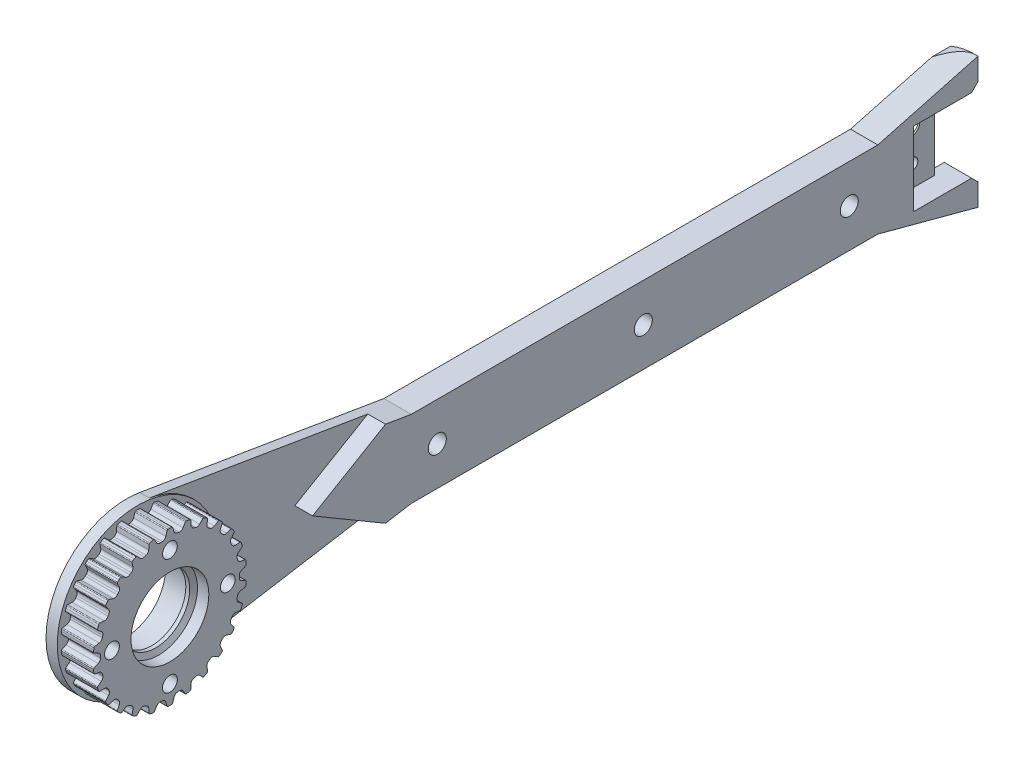
from build123d import *

# Parameters (mm, degrees)
CUT_EXTRUDE1_OUTLINE_R                          = 1.5
CUT_EXTRUDE1_DEPTH                              = 4.3
CUT_EXTRUDE1_START                              = 4.3
CUT_EXTRUDE1_2_OUTLINE_R                        = 9
CUT_EXTRUDE1_2_OUTLINE_R_2                      = 1.5
CUT_EXTRUDE1_2_DEPTH                            = 1.5
CUT_EXTRUDE2_START                              = -1
CUT_EXTRUDE2_OUTLINE_R                          = 12.5
CUT_EXTRUDE2_OUTLINE_R_2                        = 9
CUT_EXTRUDE2_DEPTH                              = 1
CUT_EXTRUDE4_DEPTH                              = 4.3
CIRPATTERN2_COUNT                               = 26
SKETCH6_R                                       = 12.5
SKETCH6_R_2                                     = 1.5
BOSS_EXTRUDE1_DEPTH                             = 0.5
SKETCH9_R                                       = 12.5
CUT_EXTRUDE5_DEPTH                              = 1.5
SKETCH10_R                                      = 6.05
CUT_EXTRUDE6_DEPTH                              = 18.364284683
SKETCH13_R                                      = 1.15
CUT_EXTRUDE7_DEPTH                              = 18.364284683
BOSS_EXTRUDE2_START                             = 1.75
SKETCH14_R                                      = 1.15
SKETCH14_R_2                                    = 6.05
BOSS_EXTRUDE2_DEPTH                             = 1.75
CUT_EXTRUDE9_START                              = -0.25
CUT_EXTRUDE9_DEPTH                              = 0.25
BOSS_EXTRUDE3_DEPTH                             = 2.75
BOSS_EXTRUDE5_DEPTH                             = 4.25
CUT_EXTRUDE14_DEPTH                             = 10
SKETCH31_W                                      = 5.8
SKETCH31_H                                      = 11.5
CUT_EXTRUDE15_DEPTH                             = 10
CUT_EXTRUDE16_REACH                             = 130.718
CUT_EXTRUDE16_DIRECTION_2_REACH                 = 130.718
CHAMFER1_SIZE                                   = 1
SKETCH33_R                                      = 1.4
SKETCH33_R_2                                    = 0.9
CUT_EXTRUDE17_DEPTH                             = 129.800834625
CUT_EXTRUDE18_DEPTH                             = 2
SKETCH35_R                                      = 1.15
SKETCH35_R_2                                    = 6.05
BOSS_EXTRUDE6_DEPTH                             = 0.7
CSK_FOR_M2_FLAT_HEAD_MACHINE_SCREW1_D           = 2.2
CSK_FOR_M2_FLAT_HEAD_MACHINE_SCREW1_DEPTH       = 7
CSK_FOR_M2_FLAT_HEAD_MACHINE_SCREW1_CSINK_D     = 4.4
CSK_FOR_M2_FLAT_HEAD_MACHINE_SCREW1_CSINK_ANGLE = 90
CSK_FOR_M2_FLAT_HEAD_MACHINE_SCREW1_TIP         = 0.660946681
SKETCH41_W                                      = 72.486755268
SKETCH41_H                                      = 12
SACRIFICIAL_LAYER_DEPTH                         = 0.15


with BuildPart() as part:
    # Cut-Extrude1: read off the stored shape, not the designer's step
    # Cut-Extrude1 outline → Cut-Extrude1 (new body)
    with BuildSketch(Plane(origin=(-2.15, 0, 0), x_dir=(0, 0, -1), z_dir=(1, 0, 0))):
        with BuildLine():
            ThreePointArc((-5.975200822, 10.283087853), (-5.974138485, 10.259881419), (-5.970960361, 10.236869104))
            Line((-5.970960361, 10.236869104), (-5.843579025, 9.548518492))
            ThreePointArc((-5.843579025, 9.548518492), (-5.874898732, 9.258968465), (-6.060105603, 9.03420513))
            ThreePointArc((-6.060105603, 9.03420513), (-6.179691825, 8.952829229), (-6.298185474, 8.869870461))
            ThreePointArc((-6.298185474, 8.869870461), (-6.574018104, 8.776401206), (-6.855858203, 8.849792625))
            Line((-6.855858203, 8.849792625), (-7.454307162, 9.212988734))
            ThreePointArc((-7.454307162, 9.212988734), (-7.605767601, 9.24908541), (-7.749833168, 9.190023179))
            ThreePointArc((-7.749833168, 9.190023179), (-7.971728427, 8.998221271), (-8.188878401, 8.801063044))
            ThreePointArc((-8.188878401, 8.801063044), (-8.248734135, 8.716518561), (-8.269857124, 8.615107033))
            ThreePointArc((-8.269857124, 8.615107033), (-8.264153361, 8.561581534), (-8.247298234, 8.510459948))
            Line((-8.247298234, 8.510459948), (-7.958885285, 7.872595902))
            ThreePointArc((-7.958885285, 7.872595902), (-7.920001041, 7.583964377), (-8.04603675, 7.32140935))
            ThreePointArc((-8.04603675, 7.32140935), (-8.142673486, 7.213779228), (-8.237870592, 7.104873706))
            ThreePointArc((-8.237870592, 7.104873706), (-8.483319371, 6.948109427), (-8.774533425, 6.951919475))
            Line((-8.774533425, 6.951919475), (-9.442511063, 7.161343555))
            ThreePointArc((-9.442511063, 7.161343555), (-9.598208837, 7.160144472), (-9.723953603, 7.068321335))
            ThreePointArc((-9.723953603, 7.068321335), (-9.893499788, 6.828989831), (-10.057156726, 6.585593273))
            ThreePointArc((-10.057156726, 6.585593273), (-10.088063831, 6.519049409), (-10.098660947, 6.446447508))
            ThreePointArc((-10.098660947, 6.446447508), (-10.084695038, 6.363383466), (-10.044333112, 6.289453793))
            Line((-10.044333112, 6.289453793), (-9.611650061, 5.739146654))
            ThreePointArc((-9.611650061, 5.739146654), (-9.504821678, 5.468207845), (-9.564361488, 5.183119871))
            ThreePointArc((-9.564361488, 5.183119871), (-9.632432562, 5.0554906), (-9.698800615, 4.926967515))
            ThreePointArc((-9.698800615, 4.926967515), (-9.899600951, 4.716018785), (-10.183264658, 4.650026034))
            Line((-10.183264658, 4.650026034), (-10.881950543, 4.693507119))
            ThreePointArc((-10.881950543, 4.693507119), (-11.032837063, 4.655081963), (-11.132953199, 4.535834347))
            ThreePointArc((-11.132953199, 4.535834347), (-11.240296902, 4.262882324), (-11.340949658, 3.987392759))
            ThreePointArc((-11.340949658, 3.987392759), (-11.351708254, 3.945877461), (-11.355328859, 3.903143885))
            ThreePointArc((-11.355328859, 3.903143885), (-11.329600568, 3.791752561), (-11.257627859, 3.702927445))
            Line((-11.257627859, 3.702927445), (-10.705820672, 3.272159063))
            ThreePointArc((-10.705820672, 3.272159063), (-10.537256627, 3.034658948), (-10.5268403, 2.743606304))
            ThreePointArc((-10.5268403, 2.743606304), (-10.562389669, 2.603395234), (-10.5960716, 2.462723882))
            ThreePointArc((-10.5960716, 2.462723882), (-10.740553707, 2.209850272), (-11.000181563, 2.077889983))
            Line((-11.000181563, 2.077889983), (-11.688970611, 1.952901109))
            ThreePointArc((-11.688970611, 1.952901109), (-11.826276901, 1.879483011), (-11.894946022, 1.739741154))
            ThreePointArc((-11.894946022, 1.739741154), (-11.933848818, 1.449031591), (-11.965647819, 1.157459471))
            ThreePointArc((-11.965647819, 1.157459471), (-11.966532701, 1.145245826), (-11.96682789, 1.133003727))
            ThreePointArc((-11.96682789, 1.133003727), (-11.926008501, 0.994909457), (-11.816670195, 0.901200414))
            Line((-11.816670195, 0.901200414), (-11.177807901, 0.615005482))
            ThreePointArc((-11.177807901, 0.615005482), (-10.957304522, 0.424746706), (-10.877537418, 0.144644312))
            ThreePointArc((-10.877537418, 0.144644312), (-10.878258663, 0.072323754), (-10.878499081, 0))
            ThreePointArc((-10.878499081, 0), (-10.878258663, -0.072323754), (-10.877537418, -0.144644312))
            ThreePointArc((-10.877537418, -0.144644312), (-10.957304522, -0.424746706), (-11.177807901, -0.615005482))
            Line((-11.177807901, -0.615005482), (-11.816670195, -0.901200414))
            ThreePointArc((-11.816670195, -0.901200414), (-11.926008501, -0.994909457), (-11.96682789, -1.133003727))
            ThreePointArc((-11.96682789, -1.133003727), (-11.966532701, -1.145245826), (-11.965647819, -1.157459471))
            ThreePointArc((-11.965647819, -1.157459471), (-11.933848818, -1.449031591), (-11.894946022, -1.739741154))
            ThreePointArc((-11.894946022, -1.739741154), (-11.826276901, -1.879483011), (-11.688970611, -1.952901109))
            Line((-11.688970611, -1.952901109), (-11.000181563, -2.077889983))
            ThreePointArc((-11.000181563, -2.077889983), (-10.740553707, -2.209850272), (-10.5960716, -2.462723882))
            ThreePointArc((-10.5960716, -2.462723882), (-10.562389669, -2.603395234), (-10.5268403, -2.743606304))
            ThreePointArc((-10.5268403, -2.743606304), (-10.537256627, -3.034658948), (-10.705820672, -3.272159063))
            Line((-10.705820672, -3.272159063), (-11.257627859, -3.702927445))
            ThreePointArc((-11.257627859, -3.702927445), (-11.329600568, -3.791752561), (-11.355328859, -3.903143885))
            ThreePointArc((-11.355328859, -3.903143885), (-11.351708254, -3.945877461), (-11.340949658, -3.987392759))
            ThreePointArc((-11.340949658, -3.987392759), (-11.240296902, -4.262882324), (-11.132953199, -4.535834347))
            ThreePointArc((-11.132953199, -4.535834347), (-11.032837063, -4.655081963), (-10.881950543, -4.693507119))
            Line((-10.881950543, -4.693507119), (-10.183264658, -4.650026034))
            ThreePointArc((-10.183264658, -4.650026034), (-9.899600951, -4.716018785), (-9.698800615, -4.926967515))
            ThreePointArc((-9.698800615, -4.926967515), (-9.632432562, -5.0554906), (-9.564361488, -5.183119871))
            ThreePointArc((-9.564361488, -5.183119871), (-9.504821678, -5.468207845), (-9.611650061, -5.739146654))
            Line((-9.611650061, -5.739146654), (-10.044333112, -6.289453793))
            ThreePointArc((-10.044333112, -6.289453793), (-10.084695038, -6.363383466), (-10.098660947, -6.446447508))
            ThreePointArc((-10.098660947, -6.446447508), (-10.088063831, -6.519049409), (-10.057156726, -6.585593273))
            ThreePointArc((-10.057156726, -6.585593273), (-9.893499788, -6.828989831), (-9.723953603, -7.068321335))
            ThreePointArc((-9.723953603, -7.068321335), (-9.598208837, -7.160144472), (-9.442511063, -7.161343555))
            Line((-9.442511063, -7.161343555), (-8.774533425, -6.951919475))
            ThreePointArc((-8.774533425, -6.951919475), (-8.483319371, -6.948109427), (-8.237870592, -7.104873706))
            ThreePointArc((-8.237870592, -7.104873706), (-8.142673486, -7.213779228), (-8.04603675, -7.32140935))
            ThreePointArc((-8.04603675, -7.32140935), (-7.920001041, -7.583964377), (-7.958885285, -7.872595902))
            Line((-7.958885285, -7.872595902), (-8.247298234, -8.510459948))
            ThreePointArc((-8.247298234, -8.510459948), (-8.264153361, -8.561581534), (-8.269857124, -8.615107033))
            ThreePointArc((-8.269857124, -8.615107033), (-8.248734135, -8.716518561), (-8.188878401, -8.801063044))
            ThreePointArc((-8.188878401, -8.801063044), (-7.971728427, -8.998221271), (-7.749833168, -9.190023179))
            ThreePointArc((-7.749833168, -9.190023179), (-7.605767601, -9.24908541), (-7.454307162, -9.212988734))
            Line((-7.454307162, -9.212988734), (-6.855858203, -8.849792625))
            ThreePointArc((-6.855858203, -8.849792625), (-6.574018104, -8.776401206), (-6.298185474, -8.869870461))
            ThreePointArc((-6.298185474, -8.869870461), (-6.179691825, -8.952829229), (-6.060105603, -9.03420513))
            ThreePointArc((-6.060105603, -9.03420513), (-5.874898732, -9.258968465), (-5.843579025, -9.548518492))
            Line((-5.843579025, -9.548518492), (-5.970960361, -10.236869104))
            ThreePointArc((-5.970960361, -10.236869104), (-5.974138485, -10.259881419), (-5.975200822, -10.283087853))
            ThreePointArc((-5.975200822, -10.283087853), (-5.940156088, -10.411830198), (-5.844692228, -10.505047021))
            ThreePointArc((-5.844692228, -10.505047021), (-5.586669186, -10.644508799), (-5.325320599, -10.77763428))
            ThreePointArc((-5.325320599, -10.77763428), (-5.171306799, -10.800503124), (-5.032886025, -10.729208496))
            Line((-5.032886025, -10.729208496), (-4.538745423, -10.233347995))
            ThreePointArc((-4.538745423, -10.233347995), (-4.282658801, -10.094640447), (-3.992472709, -10.119382587))
            ThreePointArc((-3.992472709, -10.119382587), (-3.857568938, -10.171573337), (-3.721983146, -10.221965746))
            ThreePointArc((-3.721983146, -10.221965746), (-3.488368663, -10.395874962), (-3.388665193, -10.669515894))
            Line((-3.388665193, -10.669515894), (-3.347611975, -11.368348638))
            ThreePointArc((-3.347611975, -11.368348638), (-3.291279621, -11.513503385), (-3.160833788, -11.59851585))
            ThreePointArc((-3.160833788, -11.59851585), (-2.876933038, -11.672176166), (-2.591319753, -11.738888452))
            ThreePointArc((-2.591319753, -11.738888452), (-2.436308442, -11.724234854), (-2.318971846, -11.621885659))
            Line((-2.318971846, -11.621885659), (-1.957857256, -11.022178377))
            ThreePointArc((-1.957857256, -11.022178377), (-1.742406936, -10.826215878), (-1.454731942, -10.780792978))
            ThreePointArc((-1.454731942, -10.780792978), (-1.311258166, -10.799182575), (-1.167552558, -10.815662869))
            ThreePointArc((-1.167552558, -10.815662869), (-0.899107288, -10.928610993), (-0.736814457, -11.170439815))
            Line((-0.736814457, -11.170439815), (-0.529712549, -11.839141071))
            ThreePointArc((-0.529712549, -11.839141071), (-0.440279306, -11.96659667), (-0.293279177, -12.017921097))
            ThreePointArc((-0.293279177, -12.017921097), (0, -12.021499081), (0.293279177, -12.017921097))
            ThreePointArc((0.293279177, -12.017921097), (0.440279306, -11.96659667), (0.529712549, -11.839141071))
            Line((0.529712549, -11.839141071), (0.736814457, -11.170439815))
            ThreePointArc((0.736814457, -11.170439815), (0.899107288, -10.928610993), (1.167552558, -10.815662869))
            ThreePointArc((1.167552558, -10.815662869), (1.311258166, -10.799182575), (1.454731942, -10.780792978))
            ThreePointArc((1.454731942, -10.780792978), (1.742406936, -10.826215878), (1.957857256, -11.022178377))
            Line((1.957857256, -11.022178377), (2.318971846, -11.621885659))
            ThreePointArc((2.318971846, -11.621885659), (2.436308442, -11.724234854), (2.591319753, -11.738888452))
            ThreePointArc((2.591319753, -11.738888452), (2.876933038, -11.672176166), (3.160833788, -11.59851585))
            ThreePointArc((3.160833788, -11.59851585), (3.291279621, -11.513503385), (3.347611975, -11.368348638))
            Line((3.347611975, -11.368348638), (3.388665193, -10.669515894))
            ThreePointArc((3.388665193, -10.669515894), (3.488368663, -10.395874962), (3.721983146, -10.221965746))
            ThreePointArc((3.721983146, -10.221965746), (3.857568938, -10.171573337), (3.992472709, -10.119382587))
            ThreePointArc((3.992472709, -10.119382587), (4.282658801, -10.094640447), (4.538745423, -10.233347995))
            Line((4.538745423, -10.233347995), (5.032886025, -10.729208496))
            ThreePointArc((5.032886025, -10.729208496), (5.171306799, -10.800503124), (5.325320599, -10.77763428))
            ThreePointArc((5.325320599, -10.77763428), (5.586669186, -10.644508799), (5.844692228, -10.505047021))
            ThreePointArc((5.844692228, -10.505047021), (5.951002727, -10.391287132), (5.970960361, -10.236869104))
            Line((5.970960361, -10.236869104), (5.843579025, -9.548518492))
            ThreePointArc((5.843579025, -9.548518492), (5.837222777, -9.502493862), (5.835098103, -9.456080995))
            ThreePointArc((5.835098103, -9.456080995), (5.894865914, -9.217016349), (6.060105603, -9.03420513))
            ThreePointArc((6.060105603, -9.03420513), (6.179691825, -8.952829229), (6.298185474, -8.869870461))
            ThreePointArc((6.298185474, -8.869870461), (6.574018104, -8.776401206), (6.855858203, -8.849792625))
            Line((6.855858203, -8.849792625), (7.454307162, -9.212988734))
            ThreePointArc((7.454307162, -9.212988734), (7.605767601, -9.24908541), (7.749833168, -9.190023179))
            ThreePointArc((7.749833168, -9.190023179), (7.971728427, -8.998221271), (8.188878401, -8.801063044))
            ThreePointArc((8.188878401, -8.801063044), (8.264875187, -8.665167043), (8.247298234, -8.510459948))
            Line((8.247298234, -8.510459948), (7.958885285, -7.872595902))
            ThreePointArc((7.958885285, -7.872595902), (7.925175032, -7.770352728), (7.913767505, -7.663301731))
            ThreePointArc((7.913767505, -7.663301731), (7.947987375, -7.480008555), (8.04603675, -7.32140935))
            ThreePointArc((8.04603675, -7.32140935), (8.142673486, -7.213779228), (8.237870592, -7.104873706))
            ThreePointArc((8.237870592, -7.104873706), (8.483319371, -6.948109427), (8.774533425, -6.951919475))
            Line((8.774533425, -6.951919475), (9.442511063, -7.161343555))
            ThreePointArc((9.442511063, -7.161343555), (9.598208837, -7.160144472), (9.723953603, -7.068321335))
            ThreePointArc((9.723953603, -7.068321335), (9.893499788, -6.828989831), (10.057156726, -6.585593273))
            ThreePointArc((10.057156726, -6.585593273), (10.098423142, -6.435458941), (10.044333112, -6.289453793))
            Line((10.044333112, -6.289453793), (9.611650061, -5.739146654))
            ThreePointArc((9.611650061, -5.739146654), (9.530926209, -5.591287308), (9.502994392, -5.425159225))
            ThreePointArc((9.502994392, -5.425159225), (9.518575101, -5.300310347), (9.564361488, -5.183119871))
            ThreePointArc((9.564361488, -5.183119871), (9.632432562, -5.0554906), (9.698800615, -4.926967515))
            ThreePointArc((9.698800615, -4.926967515), (9.899600951, -4.716018785), (10.183264658, -4.650026034))
            Line((10.183264658, -4.650026034), (10.881950543, -4.693507119))
            ThreePointArc((10.881950543, -4.693507119), (11.032837063, -4.655081963), (11.132953199, -4.535834347))
            ThreePointArc((11.132953199, -4.535834347), (11.240296902, -4.262882324), (11.340949658, -3.987392759))
            ThreePointArc((11.340949658, -3.987392759), (11.34508745, -3.831745358), (11.257627859, -3.702927445))
            Line((11.257627859, -3.702927445), (10.705820672, -3.272159063))
            ThreePointArc((10.705820672, -3.272159063), (10.561875255, -3.094508832), (10.510418673, -2.871726185))
            ThreePointArc((10.510418673, -2.871726185), (10.514540804, -2.807142182), (10.5268403, -2.743606304))
            ThreePointArc((10.5268403, -2.743606304), (10.562389669, -2.603395234), (10.5960716, -2.462723882))
            ThreePointArc((10.5960716, -2.462723882), (10.740553707, -2.209850272), (11.000181563, -2.077889983))
            Line((11.000181563, -2.077889983), (11.688970611, -1.952901109))
            ThreePointArc((11.688970611, -1.952901109), (11.826276901, -1.879483011), (11.894946022, -1.739741154))
            ThreePointArc((11.894946022, -1.739741154), (11.933848818, -1.449031591), (11.965647819, -1.157459471))
            ThreePointArc((11.965647819, -1.157459471), (11.932416513, -1.005344663), (11.816670195, -0.901200414))
            Line((11.816670195, -0.901200414), (11.177807901, -0.615005482))
            ThreePointArc((11.177807901, -0.615005482), (10.95913129, -0.427587396), (10.877492511, -0.151398857))
            ThreePointArc((10.877492511, -0.151398857), (10.877503738, -0.14802151), (10.877537418, -0.144644312))
            ThreePointArc((10.877537418, -0.144644312), (10.878499081, 0), (10.877537418, 0.144644312))
            ThreePointArc((10.877537418, 0.144644312), (10.877503738, 0.14802151), (10.877492511, 0.151398857))
            ThreePointArc((10.877492511, 0.151398857), (10.95913129, 0.427587396), (11.177807901, 0.615005482))
            Line((11.177807901, 0.615005482), (11.816670195, 0.901200414))
            ThreePointArc((11.816670195, 0.901200414), (11.932416513, 1.005344663), (11.965647819, 1.157459471))
            ThreePointArc((11.965647819, 1.157459471), (11.933848818, 1.449031591), (11.894946022, 1.739741154))
            ThreePointArc((11.894946022, 1.739741154), (11.826276901, 1.879483011), (11.688970611, 1.952901109))
            Line((11.688970611, 1.952901109), (11.000181563, 2.077889983))
            ThreePointArc((11.000181563, 2.077889983), (10.740553707, 2.209850272), (10.5960716, 2.462723882))
            ThreePointArc((10.5960716, 2.462723882), (10.562389669, 2.603395234), (10.5268403, 2.743606304))
            ThreePointArc((10.5268403, 2.743606304), (10.514540804, 2.807142182), (10.510418673, 2.871726185))
            ThreePointArc((10.510418673, 2.871726185), (10.561875255, 3.094508832), (10.705820672, 3.272159063))
            Line((10.705820672, 3.272159063), (11.257627859, 3.702927445))
            ThreePointArc((11.257627859, 3.702927445), (11.34508745, 3.831745358), (11.340949658, 3.987392759))
            ThreePointArc((11.340949658, 3.987392759), (11.240296902, 4.262882324), (11.132953199, 4.535834347))
            ThreePointArc((11.132953199, 4.535834347), (11.032837063, 4.655081963), (10.881950543, 4.693507119))
            Line((10.881950543, 4.693507119), (10.183264658, 4.650026034))
            ThreePointArc((10.183264658, 4.650026034), (9.899600951, 4.716018785), (9.698800615, 4.926967515))
            ThreePointArc((9.698800615, 4.926967515), (9.632432562, 5.0554906), (9.564361488, 5.183119871))
            ThreePointArc((9.564361488, 5.183119871), (9.518575101, 5.300310347), (9.502994392, 5.425159225))
            ThreePointArc((9.502994392, 5.425159225), (9.530926209, 5.591287308), (9.611650061, 5.739146654))
            Line((9.611650061, 5.739146654), (10.044333112, 6.289453793))
            ThreePointArc((10.044333112, 6.289453793), (10.098423142, 6.435458941), (10.057156726, 6.585593273))
            ThreePointArc((10.057156726, 6.585593273), (9.893499788, 6.828989831), (9.723953603, 7.068321335))
            ThreePointArc((9.723953603, 7.068321335), (9.598208837, 7.160144472), (9.442511063, 7.161343555))
            Line((9.442511063, 7.161343555), (8.774533425, 6.951919475))
            ThreePointArc((8.774533425, 6.951919475), (8.483319371, 6.948109427), (8.237870592, 7.104873706))
            ThreePointArc((8.237870592, 7.104873706), (8.142673486, 7.213779228), (8.04603675, 7.32140935))
            ThreePointArc((8.04603675, 7.32140935), (7.947987375, 7.480008555), (7.913767505, 7.663301731))
            ThreePointArc((7.913767505, 7.663301731), (7.925175032, 7.770352728), (7.958885285, 7.872595902))
            Line((7.958885285, 7.872595902), (8.247298234, 8.510459948))
            ThreePointArc((8.247298234, 8.510459948), (8.264875187, 8.665167043), (8.188878401, 8.801063044))
            ThreePointArc((8.188878401, 8.801063044), (7.971728427, 8.998221271), (7.749833168, 9.190023179))
            ThreePointArc((7.749833168, 9.190023179), (7.605767601, 9.24908541), (7.454307162, 9.212988734))
            Line((7.454307162, 9.212988734), (6.855858203, 8.849792625))
            ThreePointArc((6.855858203, 8.849792625), (6.574018104, 8.776401206), (6.298185474, 8.869870461))
            ThreePointArc((6.298185474, 8.869870461), (6.179691825, 8.952829229), (6.060105603, 9.03420513))
            ThreePointArc((6.060105603, 9.03420513), (5.894865914, 9.217016349), (5.835098103, 9.456080995))
            ThreePointArc((5.835098103, 9.456080995), (5.837222777, 9.502493862), (5.843579025, 9.548518492))
            Line((5.843579025, 9.548518492), (5.970960361, 10.236869104))
            ThreePointArc((5.970960361, 10.236869104), (5.951002727, 10.391287132), (5.844692228, 10.505047021))
            ThreePointArc((5.844692228, 10.505047021), (5.586669186, 10.644508799), (5.325320599, 10.77763428))
            ThreePointArc((5.325320599, 10.77763428), (5.171306799, 10.800503124), (5.032886025, 10.729208496))
            Line((5.032886025, 10.729208496), (4.538745423, 10.233347995))
            ThreePointArc((4.538745423, 10.233347995), (4.282658801, 10.094640447), (3.992472709, 10.119382587))
            ThreePointArc((3.992472709, 10.119382587), (3.857568938, 10.171573337), (3.721983146, 10.221965746))
            ThreePointArc((3.721983146, 10.221965746), (3.488368663, 10.395874962), (3.388665193, 10.669515894))
            Line((3.388665193, 10.669515894), (3.347611975, 11.368348638))
            ThreePointArc((3.347611975, 11.368348638), (3.291279621, 11.513503385), (3.160833788, 11.59851585))
            ThreePointArc((3.160833788, 11.59851585), (2.876933038, 11.672176166), (2.591319753, 11.738888452))
            ThreePointArc((2.591319753, 11.738888452), (2.436308442, 11.724234854), (2.318971846, 11.621885659))
            Line((2.318971846, 11.621885659), (1.957857256, 11.022178377))
            ThreePointArc((1.957857256, 11.022178377), (1.742406936, 10.826215878), (1.454731942, 10.780792978))
            ThreePointArc((1.454731942, 10.780792978), (1.311258166, 10.799182575), (1.167552558, 10.815662869))
            ThreePointArc((1.167552558, 10.815662869), (0.899107288, 10.928610993), (0.736814457, 11.170439815))
            Line((0.736814457, 11.170439815), (0.529712549, 11.839141071))
            ThreePointArc((0.529712549, 11.839141071), (0.440279306, 11.96659667), (0.293279177, 12.017921097))
            ThreePointArc((0.293279177, 12.017921097), (0, 12.021499081), (-0.293279177, 12.017921097))
            ThreePointArc((-0.293279177, 12.017921097), (-0.440279306, 11.96659667), (-0.529712549, 11.839141071))
            Line((-0.529712549, 11.839141071), (-0.736814457, 11.170439815))
            ThreePointArc((-0.736814457, 11.170439815), (-0.899107288, 10.928610993), (-1.167552558, 10.815662869))
            ThreePointArc((-1.167552558, 10.815662869), (-1.311258166, 10.799182575), (-1.454731942, 10.780792978))
            ThreePointArc((-1.454731942, 10.780792978), (-1.742406936, 10.826215878), (-1.957857256, 11.022178377))
            Line((-1.957857256, 11.022178377), (-2.318971846, 11.621885659))
            ThreePointArc((-2.318971846, 11.621885659), (-2.436308442, 11.724234854), (-2.591319753, 11.738888452))
            ThreePointArc((-2.591319753, 11.738888452), (-2.876933038, 11.672176166), (-3.160833788, 11.59851585))
            ThreePointArc((-3.160833788, 11.59851585), (-3.291279621, 11.513503385), (-3.347611975, 11.368348638))
            Line((-3.347611975, 11.368348638), (-3.388665193, 10.669515894))
            ThreePointArc((-3.388665193, 10.669515894), (-3.488368663, 10.395874962), (-3.721983146, 10.221965746))
            ThreePointArc((-3.721983146, 10.221965746), (-3.857568938, 10.171573337), (-3.992472709, 10.119382587))
            ThreePointArc((-3.992472709, 10.119382587), (-4.282658801, 10.094640447), (-4.538745423, 10.233347995))
            Line((-4.538745423, 10.233347995), (-5.032886025, 10.729208496))
            ThreePointArc((-5.032886025, 10.729208496), (-5.171306799, 10.800503124), (-5.325320599, 10.77763428))
            ThreePointArc((-5.325320599, 10.77763428), (-5.586669186, 10.644508799), (-5.844692228, 10.505047021))
            ThreePointArc((-5.844692228, 10.505047021), (-5.940156088, 10.411830198), (-5.975200822, 10.283087853))
        make_face()
        Circle(CUT_EXTRUDE1_OUTLINE_R, mode=Mode.SUBTRACT)
    extrude(amount=CUT_EXTRUDE1_DEPTH)

    # Cut-Extrude1 2 outline → Cut-Extrude1 2 (add)
    with BuildSketch(Plane(origin=(-2.15, 0, 0), x_dir=(0, 0, -1), z_dir=(1, 0, 0)).offset(CUT_EXTRUDE1_START)):
        Circle(CUT_EXTRUDE1_2_OUTLINE_R)
        Circle(CUT_EXTRUDE1_2_OUTLINE_R_2, mode=Mode.SUBTRACT)
    extrude(amount=CUT_EXTRUDE1_2_DEPTH)

    # Sketch4 → Cut-Extrude4 (cut)
    with BuildSketch(Plane.ZY.offset(2.15)):
        with BuildLine():
            Line((-2.04352513, 10.970593346), (-2.404639719, 11.570300628))
            ThreePointArc((-2.404639719, 11.570300628), (-2.475780805, 11.632354864), (-2.569764041, 11.641239329))
            Line((-2.569764041, 11.641239329), (-2.863618689, 11.576371914))
            Line((-2.863618689, 11.576371914), (-2.88995125, 11.683207311))
            Line((-2.88995125, 11.683207311), (-2.593475325, 11.748653365))
            ThreePointArc((-2.593475325, 11.748653365), (-2.432361206, 11.733422853), (-2.310405058, 11.627044162))
            Line((-2.310405058, 11.627044162), (-1.949290469, 11.02733688))
            ThreePointArc((-1.949290469, 11.02733688), (-1.738081296, 10.83523191), (-1.456069196, 10.790703162))
            ThreePointArc((-1.456069196, 10.790703162), (-1.312463532, 10.809109664), (-1.168625824, 10.825605107))
            ThreePointArc((-1.168625824, 10.825605107), (-0.90546491, 10.936329843), (-0.74636682, 11.173398255))
            Line((-0.74636682, 11.173398255), (-0.539264911, 11.842099511))
            ThreePointArc((-0.539264911, 11.842099511), (-0.446310675, 11.974573047), (-0.293523139, 12.02791812))
            Line((-0.293523139, 12.02791812), (0.01, 12.035325143))
            Line((0.01, 12.035325143), (0.01, 11.925292394))
            Line((0.01, 11.925292394), (-0.290839555, 11.91795086))
            ThreePointArc((-0.290839555, 11.91795086), (-0.379965617, 11.886832901), (-0.434188922, 11.809556671))
            Line((-0.434188922, 11.809556671), (-0.64129083, 11.140855415))
            ThreePointArc((-0.64129083, 11.140855415), (-0.835531068, 10.851422495), (-1.156819895, 10.716240487))
            ThreePointArc((-1.156819895, 10.716240487), (-1.299204497, 10.699911687), (-1.441359399, 10.681691136))
            ThreePointArc((-1.441359399, 10.681691136), (-1.785663329, 10.736055551), (-2.04352513, 10.970593346))
        make_face()
    cut_extrude4 = extrude(amount=-CUT_EXTRUDE4_DEPTH, mode=Mode.SUBTRACT)

    # CirPattern2: Cut-Extrude4 ×26 about axis
    cirpattern2_axis = Axis((0, 0, 0), (1, 0, 0))
    for i in range(1, CIRPATTERN2_COUNT):
        add(cut_extrude4.rotate(cirpattern2_axis, i * 360 / CIRPATTERN2_COUNT), mode=Mode.SUBTRACT)



with BuildPart() as body_2:
    # Cut-Extrude2: read off the stored shape, not the designer's step
    # Cut-Extrude2 outline → Cut-Extrude2 (new body)
    with BuildSketch(Plane.ZY.offset(-2.15).offset(CUT_EXTRUDE2_START)):
        Circle(CUT_EXTRUDE2_OUTLINE_R)
        Circle(CUT_EXTRUDE2_OUTLINE_R_2, mode=Mode.SUBTRACT)
    extrude(amount=CUT_EXTRUDE2_DEPTH)


with BuildPart() as part_1:
    add(part.part)

    add(body_2.part)  # Boss-Extrude1 merges body 2
    # Sketch6 → Boss-Extrude1 (add)
    with BuildSketch(Plane(origin=(3.15, 0, 0), x_dir=(0, 0, -1), z_dir=(1, 0, 0))):
        with Locations(Location((0, 0, 0), (0, 0, 180))):
            Circle(SKETCH6_R)
        with Locations(Location((0, 0, 0), (0, 0, 180))):
            Circle(SKETCH6_R_2, mode=Mode.SUBTRACT)
    extrude(amount=BOSS_EXTRUDE1_DEPTH)

    # Sketch9 → Cut-Extrude5 (cut)
    with BuildSketch(Plane(origin=(3.65, 0, 0), x_dir=(0, 0, -1), z_dir=(1, 0, 0))):
        Circle(SKETCH9_R)
    extrude(amount=-CUT_EXTRUDE5_DEPTH, mode=Mode.SUBTRACT)

    # Sketch10 → Cut-Extrude6 (cut, through all)
    with BuildSketch(Plane(origin=(2.15, 0, 0), x_dir=(0, 0, -1), z_dir=(1, 0, 0))):
        Circle(SKETCH10_R)
    extrude(amount=-CUT_EXTRUDE6_DEPTH, mode=Mode.SUBTRACT)

    # Sketch13 → Cut-Extrude7 (cut, through all)
    with BuildSketch(Plane.ZY.offset(2.15)):
        with Locations((0, 9)):
            Circle(SKETCH13_R)
        with Locations((9, 0)):
            Circle(SKETCH13_R)
        with Locations((0, -9)):
            Circle(SKETCH13_R)
        with Locations((-9, 0)):
            Circle(SKETCH13_R)
    extrude(amount=-CUT_EXTRUDE7_DEPTH, mode=Mode.SUBTRACT)

    # Sketch14 → Boss-Extrude2 (add)
    with BuildSketch(Plane.ZY.offset(2.15).offset(BOSS_EXTRUDE2_START)):
        with BuildLine():
            Line((-2.056806903, 12.32962065), (-40, 6))
            Line((-40, 6), (-40, -6))
            Line((-40, -6), (-2.056806903, -12.32962065))
            ThreePointArc((-2.056806903, -12.32962065), (12.5, 0), (-2.056806903, 12.32962065))
        make_face()
        with Locations((-9, 0)):
            Circle(SKETCH14_R, mode=Mode.SUBTRACT)
        with Locations((0, -9)):
            Circle(SKETCH14_R, mode=Mode.SUBTRACT)
        with Locations((9, 0)):
            Circle(SKETCH14_R, mode=Mode.SUBTRACT)
        with Locations((0, 9)):
            Circle(SKETCH14_R, mode=Mode.SUBTRACT)
        with Locations(Location((0, 0, 0), (0, 0, 180))):
            Circle(SKETCH14_R_2, mode=Mode.SUBTRACT)
    extrude(amount=-BOSS_EXTRUDE2_DEPTH)

    # Sketch19 → Cut-Extrude9 (cut)
    with BuildSketch(Plane(origin=(-2.15, 0, 0), x_dir=(0, 0, -1), z_dir=(1, 0, 0)).offset(CUT_EXTRUDE9_START)):
        with BuildLine():
            Line((2.056806903, -12.32962065), (40, -6))
            Line((40, -6), (40, 6))
            Line((40, 6), (2.056806903, 12.32962065))
            ThreePointArc((2.056806903, 12.32962065), (12.5, 0), (2.056806903, -12.32962065))
        make_face()
    extrude(amount=CUT_EXTRUDE9_DEPTH, mode=Mode.SUBTRACT)

    # Sketch20 → Boss-Extrude3 (add)
    with BuildSketch(Plane(origin=(-2.4, 0, 0), x_dir=(0, 0, -1), z_dir=(1, 0, 0))):
        Polygon((40, 6), (40, -6), (36, -6.667273377), (24.661131694, 0), (36, 6.667273377), align=None)
    extrude(amount=BOSS_EXTRUDE3_DEPTH)

    # Sketch29 → Boss-Extrude5 (add)
    with BuildSketch(Plane.ZY.offset(3.9)):
        Polygon((-40, -6), (-40, 6), (-112.486755268, 6), (-128.05, 10.170158858), (-128.05, -10.170158858), (-112.486755268, -6), align=None)
    extrude(amount=-BOSS_EXTRUDE5_DEPTH)

    # Sketch30 → Cut-Extrude14 (cut)
    with BuildSketch(Plane(origin=(0, 0, -128.05), x_dir=(-1, 0, 0), z_dir=(0, 0, -1))):
        with BuildLine():
            Line((0, 10.170158858), (3.9, 10.170158858))
            Line((3.9, 10.170158858), (3.9, 9.39266369))
            ThreePointArc((3.9, 9.39266369), (1.988372371, 9.973891242), (0, 10.170158858))
        make_face()
        with BuildLine():
            Line((0, -10.170158858), (3.9, -10.170158858))
            Line((3.9, -10.170158858), (3.9, -9.39266369))
            ThreePointArc((3.9, -9.39266369), (1.988372371, -9.973891242), (0, -10.170158858))
        make_face()
    extrude(amount=-CUT_EXTRUDE14_DEPTH, mode=Mode.SUBTRACT)

    # Sketch31 → Cut-Extrude15 (cut)
    with BuildSketch(Plane(origin=(0, 0, -128.05), x_dir=(-1, 0, 0), z_dir=(0, 0, -1))):
        Rectangle(SKETCH31_W, SKETCH31_H)
    extrude(amount=-CUT_EXTRUDE15_DEPTH, mode=Mode.SUBTRACT)

    # Cut-Extrude16: up to this face of the body (flat: up to its plane)
    cut_extrude16_end = Plane(part_1.part.faces().sort_by_distance((-1.275, -5.75, -123.05))[0])
    # Sketch32 → Cut-Extrude16 (cut, up to the picked face)
    with BuildSketch(Plane(origin=(0, 0, 0), x_dir=(1, 0, 0), z_dir=(0, 1, 0)), mode=Mode.PRIVATE) as cut_extrude16_sk1:
        Polygon((-2.9, 124.55), (-2.9, 128.05), (-6.4, 128.05), align=None)
    cut_extrude16_tool1 = split(extrude(cut_extrude16_sk1.sketch, amount=-CUT_EXTRUDE16_REACH, mode=Mode.PRIVATE), bisect_by=cut_extrude16_end, keep=Keep.BOTH, mode=Mode.PRIVATE)
    add(cut_extrude16_tool1.solids().sort_by(Axis((-4.066667, 0, -126.883333), (0, -1, 0)))[0], mode=Mode.SUBTRACT)

    # Cut-Extrude16 direction 2: up to this face of the body (flat: up to its plane)
    cut_extrude16_direction_2_end = Plane(part_1.part.faces().sort_by_distance((-1.275, 5.75, -123.05))[0])
    # Sketch32 → Cut-Extrude16 direction 2 (cut, up to the picked face)
    with BuildSketch(Plane(origin=(0, 0, 0), x_dir=(1, 0, 0), z_dir=(0, 1, 0)), mode=Mode.PRIVATE) as cut_extrude16_direction_2_sk1:
        Polygon((-2.9, 124.55), (-2.9, 128.05), (-6.4, 128.05), align=None)
    cut_extrude16_direction_2_tool1 = split(extrude(cut_extrude16_direction_2_sk1.sketch, amount=CUT_EXTRUDE16_DIRECTION_2_REACH, mode=Mode.PRIVATE), bisect_by=cut_extrude16_direction_2_end, keep=Keep.BOTH, mode=Mode.PRIVATE)
    add(cut_extrude16_direction_2_tool1.solids().sort_by(Axis((-4.066667, 0, -126.883333), (0, 1, 0)))[0], mode=Mode.SUBTRACT)

    # Chamfer1
    chamfer1_edges = [part_1.edges().sort_by_distance(p)[0] for p in [
        (-1.775, -5.75, -128.05),
        (-1.775, 5.75, -128.05),
    ]]
    chamfer(chamfer1_edges, length=CHAMFER1_SIZE)

    # Sketch33 → Cut-Extrude17 (cut, through all)
    with BuildSketch(Plane.ZY.offset(3.9)):
        with Locations((-44.05, 0)):
            Circle(SKETCH33_R)
        with Locations((-76.05, 0)):
            Circle(SKETCH33_R)
        with Locations((-108.05, 0)):
            Circle(SKETCH33_R)
        with Locations((-121.05, -2.5)):
            Circle(SKETCH33_R_2)
    extrude(amount=-CUT_EXTRUDE17_DEPTH, mode=Mode.SUBTRACT)

    # Sketch34 → Cut-Extrude18 (cut)
    with BuildSketch(Plane.ZY.offset(3.9)):
        Polygon((-110.907883832, 0), (-109.478941916, -2.475), (-106.621058084, -2.475), (-105.192116168, 0), (-106.621058084, 2.475), (-109.478941916, 2.475), align=None)
        Polygon((-78.907883832, 0), (-77.478941916, -2.475), (-74.621058084, -2.475), (-73.192116168, 0), (-74.621058084, 2.475), (-77.478941916, 2.475), align=None)
        Polygon((-46.907883832, 0), (-45.478941916, -2.475), (-42.621058084, -2.475), (-41.192116168, 0), (-42.621058084, 2.475), (-45.478941916, 2.475), align=None)
    extrude(amount=-CUT_EXTRUDE18_DEPTH, mode=Mode.SUBTRACT)

    # Sketch35 → Boss-Extrude6 (add)
    with BuildSketch(Plane(origin=(2.15, 0, 0), x_dir=(0, 0, -1), z_dir=(1, 0, 0))):
        with BuildLine():
            Line((0, 11.925048359), (-0.290839555, 11.91795086))
            ThreePointArc((-0.290839555, 11.91795086), (-0.379965617, 11.886832901), (-0.434188922, 11.809556671))
            Line((-0.434188922, 11.809556671), (-0.64129083, 11.140855415))
            ThreePointArc((-0.64129083, 11.140855415), (-0.835531068, 10.851422495), (-1.156819895, 10.716240487))
            ThreePointArc((-1.156819895, 10.716240487), (-1.299204497, 10.699911687), (-1.441359399, 10.681691136))
            ThreePointArc((-1.441359399, 10.681691136), (-1.785663329, 10.736055551), (-2.04352513, 10.970593346))
            Line((-2.04352513, 10.970593346), (-2.404639719, 11.570300628))
            ThreePointArc((-2.404639719, 11.570300628), (-2.475780805, 11.632354864), (-2.569764041, 11.641239329))
            Line((-2.569764041, 11.641239329), (-2.85385087, 11.578528127))
            Line((-2.85385087, 11.578528127), (-3.134540613, 11.502034407))
            ThreePointArc((-3.134540613, 11.502034407), (-3.213629819, 11.450491416), (-3.24778408, 11.362484207))
            Line((-3.24778408, 11.362484207), (-3.288837299, 10.663651463))
            ThreePointArc((-3.288837299, 10.663651463), (-3.408167437, 10.336144206), (-3.687769022, 10.128000893))
            ThreePointArc((-3.687769022, 10.128000893), (-3.822108449, 10.078071713), (-3.955772125, 10.026360723))
            ThreePointArc((-3.955772125, 10.026360723), (-4.303081464, 9.996748083), (-4.609578838, 10.162760267))
            Line((-4.609578838, 10.162760267), (-5.10371944, 10.658620768))
            ThreePointArc((-5.10371944, 10.658620768), (-5.187643846, 10.701846645), (-5.281022292, 10.687981283))
            Line((-5.281022292, 10.687981283), (-5.5418463, 10.559105926))
            Line((-5.5418463, 10.559105926), (-5.796073564, 10.417661522))
            ThreePointArc((-5.796073564, 10.417661522), (-5.860529536, 10.348688991), (-5.872629834, 10.255065462))
            Line((-5.872629834, 10.255065462), (-5.745248498, 9.566714849))
            ThreePointArc((-5.745248498, 9.566714849), (-5.782733502, 9.220166786), (-6.004398418, 8.9511587))
            ThreePointArc((-6.004398418, 8.9511587), (-6.122885351, 8.870530842), (-6.240289753, 8.788334669))
            ThreePointArc((-6.240289753, 8.788334669), (-6.570420145, 8.676465953), (-6.907740579, 8.764304502))
            Line((-6.907740579, 8.764304502), (-7.506189538, 9.127500612))
            ThreePointArc((-7.506189538, 9.127500612), (-7.598019883, 9.149385998), (-7.685366722, 9.113576614))
            Line((-7.685366722, 9.113576614), (-7.907769768, 8.926026869))
            Line((-7.907769768, 8.926026869), (-8.120759788, 8.727852016))
            ThreePointArc((-8.120759788, 8.727852016), (-8.166836579, 8.645458378), (-8.156179687, 8.551659588))
            Line((-8.156179687, 8.551659588), (-7.867766737, 7.913795542))
            ThreePointArc((-7.867766737, 7.913795542), (-7.821228115, 7.568346787), (-7.972074003, 7.2541077))
            ThreePointArc((-7.972074003, 7.2541077), (-8.067822412, 7.147466963), (-8.162144423, 7.039562548))
            ThreePointArc((-8.162144423, 7.039562548), (-8.45590989, 6.85193916), (-8.804449546, 6.856499217))
            Line((-8.804449546, 6.856499217), (-9.472427184, 7.065923297))
            ThreePointArc((-9.472427184, 7.065923297), (-9.566826622, 7.065196294), (-9.643065574, 7.009523998))
            Line((-9.643065574, 7.009523998), (-9.8141224, 6.774199576))
            Line((-9.8141224, 6.774199576), (-9.97349697, 6.530811476))
            ThreePointArc((-9.97349697, 6.530811476), (-9.998516766, 6.439785149), (-9.965722024, 6.351262342))
            Line((-9.965722024, 6.351262342), (-9.533038972, 5.800955203))
            ThreePointArc((-9.533038972, 5.800955203), (-9.40518138, 5.476681982), (-9.476441625, 5.135474329))
            ThreePointArc((-9.476441625, 5.135474329), (-9.543886959, 5.009018283), (-9.609644928, 4.881676639))
            ThreePointArc((-9.609644928, 4.881676639), (-9.849972889, 4.629202568), (-10.189475908, 4.550219119))
            Line((-10.189475908, 4.550219119), (-10.888161793, 4.593700204))
            ThreePointArc((-10.888161793, 4.593700204), (-10.979644171, 4.570403062), (-11.040344506, 4.498103326))
            Line((-11.040344506, 4.498103326), (-11.150113911, 4.228680426))
            Line((-11.150113911, 4.228680426), (-11.246610761, 3.954223911))
            ThreePointArc((-11.246610761, 3.954223911), (-11.249119501, 3.859855014), (-11.19609282, 3.781752815))
            Line((-11.19609282, 3.781752815), (-10.644285633, 3.350984433))
            ThreePointArc((-10.644285633, 3.350984433), (-10.442539689, 3.066732328), (-10.430072904, 2.718385855))
            ThreePointArc((-10.430072904, 2.718385855), (-10.465295487, 2.579463668), (-10.498667799, 2.440085429))
            ThreePointArc((-10.498667799, 2.440085429), (-10.671591266, 2.13743355), (-10.982326968, 1.979496825))
            Line((-10.982326968, 1.979496825), (-11.671116015, 1.854507952))
            ThreePointArc((-11.671116015, 1.854507952), (-11.754364711, 1.809994617), (-11.795998745, 1.725269239))
            Line((-11.795998745, 1.725269239), (-11.83810133, 1.437405741))
            Line((-11.83810133, 1.437405741), (-11.866112414, 1.147831225))
            ThreePointArc((-11.866112414, 1.147831225), (-11.845964299, 1.055604137), (-11.775787398, 0.992461561))
            Line((-11.775787398, 0.992461561), (-11.136925103, 0.706266629))
            ThreePointArc((-11.136925103, 0.706266629), (-10.873015548, 0.478555337), (-10.777546258, 0.143314677))
            ThreePointArc((-10.777546258, 0.143314677), (-10.778499081, 0), (-10.777546258, -0.143314677))
            ThreePointArc((-10.777546258, -0.143314677), (-10.873015548, -0.478555337), (-11.136925103, -0.706266629))
            Line((-11.136925103, -0.706266629), (-11.775787398, -0.992461561))
            ThreePointArc((-11.775787398, -0.992461561), (-11.845964299, -1.055604137), (-11.866112414, -1.147831225))
            Line((-11.866112414, -1.147831225), (-11.83810133, -1.437405741))
            Line((-11.83810133, -1.437405741), (-11.795998745, -1.725269239))
            ThreePointArc((-11.795998745, -1.725269239), (-11.754364711, -1.809994617), (-11.671116015, -1.854507952))
            Line((-11.671116015, -1.854507952), (-10.982326968, -1.979496825))
            ThreePointArc((-10.982326968, -1.979496825), (-10.671591266, -2.13743355), (-10.498667799, -2.440085429))
            ThreePointArc((-10.498667799, -2.440085429), (-10.465295487, -2.579463668), (-10.430072904, -2.718385855))
            ThreePointArc((-10.430072904, -2.718385855), (-10.442539689, -3.066732328), (-10.644285633, -3.350984433))
            Line((-10.644285633, -3.350984433), (-11.19609282, -3.781752815))
            ThreePointArc((-11.19609282, -3.781752815), (-11.249119501, -3.859855014), (-11.246610761, -3.954223911))
            Line((-11.246610761, -3.954223911), (-11.150113911, -4.228680426))
            Line((-11.150113911, -4.228680426), (-11.040344506, -4.498103326))
            ThreePointArc((-11.040344506, -4.498103326), (-10.979644171, -4.570403062), (-10.888161793, -4.593700204))
            Line((-10.888161793, -4.593700204), (-10.189475908, -4.550219119))
            ThreePointArc((-10.189475908, -4.550219119), (-9.849972889, -4.629202568), (-9.609644928, -4.881676639))
            ThreePointArc((-9.609644928, -4.881676639), (-9.543886959, -5.009018283), (-9.476441625, -5.135474329))
            ThreePointArc((-9.476441625, -5.135474329), (-9.40518138, -5.476681982), (-9.533038972, -5.800955203))
            Line((-9.533038972, -5.800955203), (-9.965722024, -6.351262342))
            ThreePointArc((-9.965722024, -6.351262342), (-9.998516766, -6.439785149), (-9.97349697, -6.530811476))
            Line((-9.97349697, -6.530811476), (-9.8141224, -6.774199576))
            Line((-9.8141224, -6.774199576), (-9.643065574, -7.009523998))
            ThreePointArc((-9.643065574, -7.009523998), (-9.566826622, -7.065196294), (-9.472427184, -7.065923297))
            Line((-9.472427184, -7.065923297), (-8.804449546, -6.856499217))
            ThreePointArc((-8.804449546, -6.856499217), (-8.45590989, -6.85193916), (-8.162144423, -7.039562548))
            ThreePointArc((-8.162144423, -7.039562548), (-8.067822412, -7.147466963), (-7.972074003, -7.2541077))
            ThreePointArc((-7.972074003, -7.2541077), (-7.821228115, -7.568346787), (-7.867766737, -7.913795542))
            Line((-7.867766737, -7.913795542), (-8.156179687, -8.551659588))
            ThreePointArc((-8.156179687, -8.551659588), (-8.166836579, -8.645458378), (-8.120759788, -8.727852016))
            Line((-8.120759788, -8.727852016), (-7.907769768, -8.926026869))
            Line((-7.907769768, -8.926026869), (-7.685366722, -9.113576614))
            ThreePointArc((-7.685366722, -9.113576614), (-7.598019883, -9.149385998), (-7.506189538, -9.127500612))
            Line((-7.506189538, -9.127500612), (-6.907740579, -8.764304502))
            ThreePointArc((-6.907740579, -8.764304502), (-6.570420145, -8.676465953), (-6.240289753, -8.788334669))
            ThreePointArc((-6.240289753, -8.788334669), (-6.122885351, -8.870530842), (-6.004398418, -8.9511587))
            ThreePointArc((-6.004398418, -8.9511587), (-5.782733502, -9.220166786), (-5.745248498, -9.566714849))
            Line((-5.745248498, -9.566714849), (-5.872629834, -10.255065462))
            ThreePointArc((-5.872629834, -10.255065462), (-5.860529536, -10.348688991), (-5.796073564, -10.417661522))
            Line((-5.796073564, -10.417661522), (-5.5418463, -10.559105926))
            Line((-5.5418463, -10.559105926), (-5.281022292, -10.687981283))
            ThreePointArc((-5.281022292, -10.687981283), (-5.187643846, -10.701846645), (-5.10371944, -10.658620768))
            Line((-5.10371944, -10.658620768), (-4.609578838, -10.162760267))
            ThreePointArc((-4.609578838, -10.162760267), (-4.303081464, -9.996748083), (-3.955772125, -10.026360723))
            ThreePointArc((-3.955772125, -10.026360723), (-3.822108449, -10.078071713), (-3.687769022, -10.128000893))
            ThreePointArc((-3.687769022, -10.128000893), (-3.408167437, -10.336144206), (-3.288837299, -10.663651463))
            Line((-3.288837299, -10.663651463), (-3.24778408, -11.362484207))
            ThreePointArc((-3.24778408, -11.362484207), (-3.213629819, -11.450491416), (-3.134540613, -11.502034407))
            Line((-3.134540613, -11.502034407), (-2.85385087, -11.578528127))
            Line((-2.85385087, -11.578528127), (-2.569764041, -11.641239329))
            ThreePointArc((-2.569764041, -11.641239329), (-2.475780805, -11.632354864), (-2.404639719, -11.570300628))
            Line((-2.404639719, -11.570300628), (-2.04352513, -10.970593346))
            ThreePointArc((-2.04352513, -10.970593346), (-1.785663329, -10.736055551), (-1.441359399, -10.681691136))
            ThreePointArc((-1.441359399, -10.681691136), (-1.299204497, -10.699911687), (-1.156819895, -10.716240487))
            ThreePointArc((-1.156819895, -10.716240487), (-0.835531068, -10.851422495), (-0.64129083, -11.140855415))
            Line((-0.64129083, -11.140855415), (-0.434188922, -11.809556671))
            ThreePointArc((-0.434188922, -11.809556671), (-0.379965617, -11.886832901), (-0.290839555, -11.91795086))
            Line((-0.290839555, -11.91795086), (0, -11.925048359))
            Line((0, -11.925048359), (0.290839555, -11.91795086))
            ThreePointArc((0.290839555, -11.91795086), (0.379965617, -11.886832901), (0.434188922, -11.809556671))
            Line((0.434188922, -11.809556671), (0.64129083, -11.140855415))
            ThreePointArc((0.64129083, -11.140855415), (0.835531068, -10.851422495), (1.156819895, -10.716240487))
            ThreePointArc((1.156819895, -10.716240487), (1.299204497, -10.699911687), (1.441359399, -10.681691136))
            ThreePointArc((1.441359399, -10.681691136), (1.785663329, -10.736055551), (2.04352513, -10.970593346))
            Line((2.04352513, -10.970593346), (2.404639719, -11.570300628))
            ThreePointArc((2.404639719, -11.570300628), (2.475780805, -11.632354864), (2.569764041, -11.641239329))
            Line((2.569764041, -11.641239329), (2.85385087, -11.578528127))
            Line((2.85385087, -11.578528127), (3.134540613, -11.502034407))
            ThreePointArc((3.134540613, -11.502034407), (3.213629819, -11.450491416), (3.24778408, -11.362484207))
            Line((3.24778408, -11.362484207), (3.288837299, -10.663651463))
            ThreePointArc((3.288837299, -10.663651463), (3.408167437, -10.336144206), (3.687769022, -10.128000893))
            ThreePointArc((3.687769022, -10.128000893), (3.822108449, -10.078071713), (3.955772125, -10.026360723))
            ThreePointArc((3.955772125, -10.026360723), (4.303081464, -9.996748083), (4.609578838, -10.162760267))
            Line((4.609578838, -10.162760267), (5.10371944, -10.658620768))
            ThreePointArc((5.10371944, -10.658620768), (5.187643846, -10.701846645), (5.281022292, -10.687981283))
            Line((5.281022292, -10.687981283), (5.5418463, -10.559105926))
            Line((5.5418463, -10.559105926), (5.796073564, -10.417661522))
            ThreePointArc((5.796073564, -10.417661522), (5.860529536, -10.348688991), (5.872629834, -10.255065462))
            Line((5.872629834, -10.255065462), (5.745248498, -9.566714849))
            ThreePointArc((5.745248498, -9.566714849), (5.782733502, -9.220166786), (6.004398418, -8.9511587))
            ThreePointArc((6.004398418, -8.9511587), (6.122885351, -8.870530842), (6.240289753, -8.788334669))
            ThreePointArc((6.240289753, -8.788334669), (6.570420145, -8.676465953), (6.907740579, -8.764304502))
            Line((6.907740579, -8.764304502), (7.506189538, -9.127500612))
            ThreePointArc((7.506189538, -9.127500612), (7.598019883, -9.149385998), (7.685366722, -9.113576614))
            Line((7.685366722, -9.113576614), (7.907769768, -8.926026869))
            Line((7.907769768, -8.926026869), (8.120759788, -8.727852016))
            ThreePointArc((8.120759788, -8.727852016), (8.166836579, -8.645458378), (8.156179687, -8.551659588))
            Line((8.156179687, -8.551659588), (7.867766737, -7.913795542))
            ThreePointArc((7.867766737, -7.913795542), (7.821228115, -7.568346787), (7.972074003, -7.2541077))
            ThreePointArc((7.972074003, -7.2541077), (8.067822412, -7.147466963), (8.162144423, -7.039562548))
            ThreePointArc((8.162144423, -7.039562548), (8.45590989, -6.85193916), (8.804449546, -6.856499217))
            Line((8.804449546, -6.856499217), (9.472427184, -7.065923297))
            ThreePointArc((9.472427184, -7.065923297), (9.566826622, -7.065196294), (9.643065574, -7.009523998))
            Line((9.643065574, -7.009523998), (9.8141224, -6.774199576))
            Line((9.8141224, -6.774199576), (9.97349697, -6.530811476))
            ThreePointArc((9.97349697, -6.530811476), (9.998516766, -6.439785149), (9.965722024, -6.351262342))
            Line((9.965722024, -6.351262342), (9.533038972, -5.800955203))
            ThreePointArc((9.533038972, -5.800955203), (9.40518138, -5.476681982), (9.476441625, -5.135474329))
            ThreePointArc((9.476441625, -5.135474329), (9.543886959, -5.009018283), (9.609644928, -4.881676639))
            ThreePointArc((9.609644928, -4.881676639), (9.849972889, -4.629202568), (10.189475908, -4.550219119))
            Line((10.189475908, -4.550219119), (10.888161793, -4.593700204))
            ThreePointArc((10.888161793, -4.593700204), (10.979644171, -4.570403062), (11.040344506, -4.498103326))
            Line((11.040344506, -4.498103326), (11.150113911, -4.228680426))
            Line((11.150113911, -4.228680426), (11.246610761, -3.954223911))
            ThreePointArc((11.246610761, -3.954223911), (11.249119501, -3.859855014), (11.19609282, -3.781752815))
            Line((11.19609282, -3.781752815), (10.644285633, -3.350984433))
            ThreePointArc((10.644285633, -3.350984433), (10.442539689, -3.066732328), (10.430072904, -2.718385855))
            ThreePointArc((10.430072904, -2.718385855), (10.465295487, -2.579463668), (10.498667799, -2.440085429))
            ThreePointArc((10.498667799, -2.440085429), (10.671591266, -2.13743355), (10.982326968, -1.979496825))
            Line((10.982326968, -1.979496825), (11.671116015, -1.854507952))
            ThreePointArc((11.671116015, -1.854507952), (11.754364711, -1.809994617), (11.795998745, -1.725269239))
            Line((11.795998745, -1.725269239), (11.83810133, -1.437405741))
            Line((11.83810133, -1.437405741), (11.866112414, -1.147831225))
            ThreePointArc((11.866112414, -1.147831225), (11.845964299, -1.055604137), (11.775787398, -0.992461561))
            Line((11.775787398, -0.992461561), (11.136925103, -0.706266629))
            ThreePointArc((11.136925103, -0.706266629), (10.873015548, -0.478555337), (10.777546258, -0.143314677))
            ThreePointArc((10.777546258, -0.143314677), (10.778499081, 0), (10.777546258, 0.143314677))
            ThreePointArc((10.777546258, 0.143314677), (10.873015548, 0.478555337), (11.136925103, 0.706266629))
            Line((11.136925103, 0.706266629), (11.775787398, 0.992461561))
            ThreePointArc((11.775787398, 0.992461561), (11.845964299, 1.055604137), (11.866112414, 1.147831225))
            Line((11.866112414, 1.147831225), (11.83810133, 1.437405741))
            Line((11.83810133, 1.437405741), (11.795998745, 1.725269239))
            ThreePointArc((11.795998745, 1.725269239), (11.754364711, 1.809994617), (11.671116015, 1.854507952))
            Line((11.671116015, 1.854507952), (10.982326968, 1.979496825))
            ThreePointArc((10.982326968, 1.979496825), (10.671591266, 2.13743355), (10.498667799, 2.440085429))
            ThreePointArc((10.498667799, 2.440085429), (10.465295487, 2.579463668), (10.430072904, 2.718385855))
            ThreePointArc((10.430072904, 2.718385855), (10.442539689, 3.066732328), (10.644285633, 3.350984433))
            Line((10.644285633, 3.350984433), (11.19609282, 3.781752815))
            ThreePointArc((11.19609282, 3.781752815), (11.249119501, 3.859855014), (11.246610761, 3.954223911))
            Line((11.246610761, 3.954223911), (11.150113911, 4.228680426))
            Line((11.150113911, 4.228680426), (11.040344506, 4.498103326))
            ThreePointArc((11.040344506, 4.498103326), (10.979644171, 4.570403062), (10.888161793, 4.593700204))
            Line((10.888161793, 4.593700204), (10.189475908, 4.550219119))
            ThreePointArc((10.189475908, 4.550219119), (9.849972889, 4.629202568), (9.609644928, 4.881676639))
            ThreePointArc((9.609644928, 4.881676639), (9.543886959, 5.009018283), (9.476441625, 5.135474329))
            ThreePointArc((9.476441625, 5.135474329), (9.40518138, 5.476681982), (9.533038972, 5.800955203))
            Line((9.533038972, 5.800955203), (9.965722024, 6.351262342))
            ThreePointArc((9.965722024, 6.351262342), (9.998516766, 6.439785149), (9.97349697, 6.530811476))
            Line((9.97349697, 6.530811476), (9.8141224, 6.774199576))
            Line((9.8141224, 6.774199576), (9.643065574, 7.009523998))
            ThreePointArc((9.643065574, 7.009523998), (9.566826622, 7.065196294), (9.472427184, 7.065923297))
            Line((9.472427184, 7.065923297), (8.804449546, 6.856499217))
            ThreePointArc((8.804449546, 6.856499217), (8.45590989, 6.85193916), (8.162144423, 7.039562548))
            ThreePointArc((8.162144423, 7.039562548), (8.067822412, 7.147466963), (7.972074003, 7.2541077))
            ThreePointArc((7.972074003, 7.2541077), (7.821228115, 7.568346787), (7.867766737, 7.913795542))
            Line((7.867766737, 7.913795542), (8.156179687, 8.551659588))
            ThreePointArc((8.156179687, 8.551659588), (8.166836579, 8.645458378), (8.120759788, 8.727852016))
            Line((8.120759788, 8.727852016), (7.907769768, 8.926026869))
            Line((7.907769768, 8.926026869), (7.685366722, 9.113576614))
            ThreePointArc((7.685366722, 9.113576614), (7.598019883, 9.149385998), (7.506189538, 9.127500612))
            Line((7.506189538, 9.127500612), (6.907740579, 8.764304502))
            ThreePointArc((6.907740579, 8.764304502), (6.570420145, 8.676465953), (6.240289753, 8.788334669))
            ThreePointArc((6.240289753, 8.788334669), (6.122885351, 8.870530842), (6.004398418, 8.9511587))
            ThreePointArc((6.004398418, 8.9511587), (5.782733502, 9.220166786), (5.745248498, 9.566714849))
            Line((5.745248498, 9.566714849), (5.872629834, 10.255065462))
            ThreePointArc((5.872629834, 10.255065462), (5.860529536, 10.348688991), (5.796073564, 10.417661522))
            Line((5.796073564, 10.417661522), (5.5418463, 10.559105926))
            Line((5.5418463, 10.559105926), (5.281022292, 10.687981283))
            ThreePointArc((5.281022292, 10.687981283), (5.187643846, 10.701846645), (5.10371944, 10.658620768))
            Line((5.10371944, 10.658620768), (4.609578838, 10.162760267))
            ThreePointArc((4.609578838, 10.162760267), (4.303081464, 9.996748083), (3.955772125, 10.026360723))
            ThreePointArc((3.955772125, 10.026360723), (3.822108449, 10.078071713), (3.687769022, 10.128000893))
            ThreePointArc((3.687769022, 10.128000893), (3.408167437, 10.336144206), (3.288837299, 10.663651463))
            Line((3.288837299, 10.663651463), (3.24778408, 11.362484207))
            ThreePointArc((3.24778408, 11.362484207), (3.213629819, 11.450491416), (3.134540613, 11.502034407))
            Line((3.134540613, 11.502034407), (2.85385087, 11.578528127))
            Line((2.85385087, 11.578528127), (2.569764041, 11.641239329))
            ThreePointArc((2.569764041, 11.641239329), (2.475780805, 11.632354864), (2.404639719, 11.570300628))
            Line((2.404639719, 11.570300628), (2.04352513, 10.970593346))
            ThreePointArc((2.04352513, 10.970593346), (1.785663329, 10.736055551), (1.441359399, 10.681691136))
            ThreePointArc((1.441359399, 10.681691136), (1.299204497, 10.699911687), (1.156819895, 10.716240487))
            ThreePointArc((1.156819895, 10.716240487), (0.835531068, 10.851422495), (0.64129083, 11.140855415))
            Line((0.64129083, 11.140855415), (0.434188922, 11.809556671))
            ThreePointArc((0.434188922, 11.809556671), (0.379965617, 11.886832901), (0.290839555, 11.91795086))
            Line((0.290839555, 11.91795086), (0, 11.925048359))
        make_face()
        with Locations(Location((-9, 0, 0), (0, 0, 180))):
            Circle(SKETCH35_R, mode=Mode.SUBTRACT)
        with Locations(Location((0, 9, 0), (0, 0, 180))):
            Circle(SKETCH35_R, mode=Mode.SUBTRACT)
        Circle(SKETCH35_R_2, mode=Mode.SUBTRACT)
        with Locations(Location((9, 0, 0), (0, 0, 180))):
            Circle(SKETCH35_R, mode=Mode.SUBTRACT)
        with Locations(Location((0, -9, 0), (0, 0, 180))):
            Circle(SKETCH35_R, mode=Mode.SUBTRACT)
    extrude(amount=BOSS_EXTRUDE6_DEPTH)

    # Sketch36 → Revolve1 (revolve)
    with BuildSketch(Plane(origin=(0, 0, 0), x_dir=(1, 0, 0), z_dir=(0, 1, 0)), mode=Mode.PRIVATE) as revolve1_sk:
        Polygon((-0.4, -6.05), (0.0434, -5.282008672), (0.6434, -5.282008672), (1.0868, -6.05), align=None)
    revolve(revolve1_sk.sketch.rotate(Axis((3.15, 0, 0), (-1, 0, 0)), 180), axis=Axis((3.15, 0, 0), (-1, 0, 0)))

    # CSK for M2 Flat Head Machine Screw1
    with Locations(Plane.ZY.offset(3.9)):
        with Locations((-121.05, 2.5)):
            CounterSinkHole(CSK_FOR_M2_FLAT_HEAD_MACHINE_SCREW1_D / 2, CSK_FOR_M2_FLAT_HEAD_MACHINE_SCREW1_CSINK_D / 2, depth=CSK_FOR_M2_FLAT_HEAD_MACHINE_SCREW1_DEPTH, counter_sink_angle=CSK_FOR_M2_FLAT_HEAD_MACHINE_SCREW1_CSINK_ANGLE)
            with Locations((0, 0, -(CSK_FOR_M2_FLAT_HEAD_MACHINE_SCREW1_DEPTH + CSK_FOR_M2_FLAT_HEAD_MACHINE_SCREW1_TIP / 2))):  # 118° drill point
                Cone(0, CSK_FOR_M2_FLAT_HEAD_MACHINE_SCREW1_D / 2, CSK_FOR_M2_FLAT_HEAD_MACHINE_SCREW1_TIP, mode=Mode.SUBTRACT)

    # Sketch41 → Sacrificial Layer (add)
    with BuildSketch(Plane.ZY.offset(1.9)):
        with Locations((-76.243377634, 0)):
            Rectangle(SKETCH41_W, SKETCH41_H)
    extrude(amount=-SACRIFICIAL_LAYER_DEPTH)


solid = part_1.part
